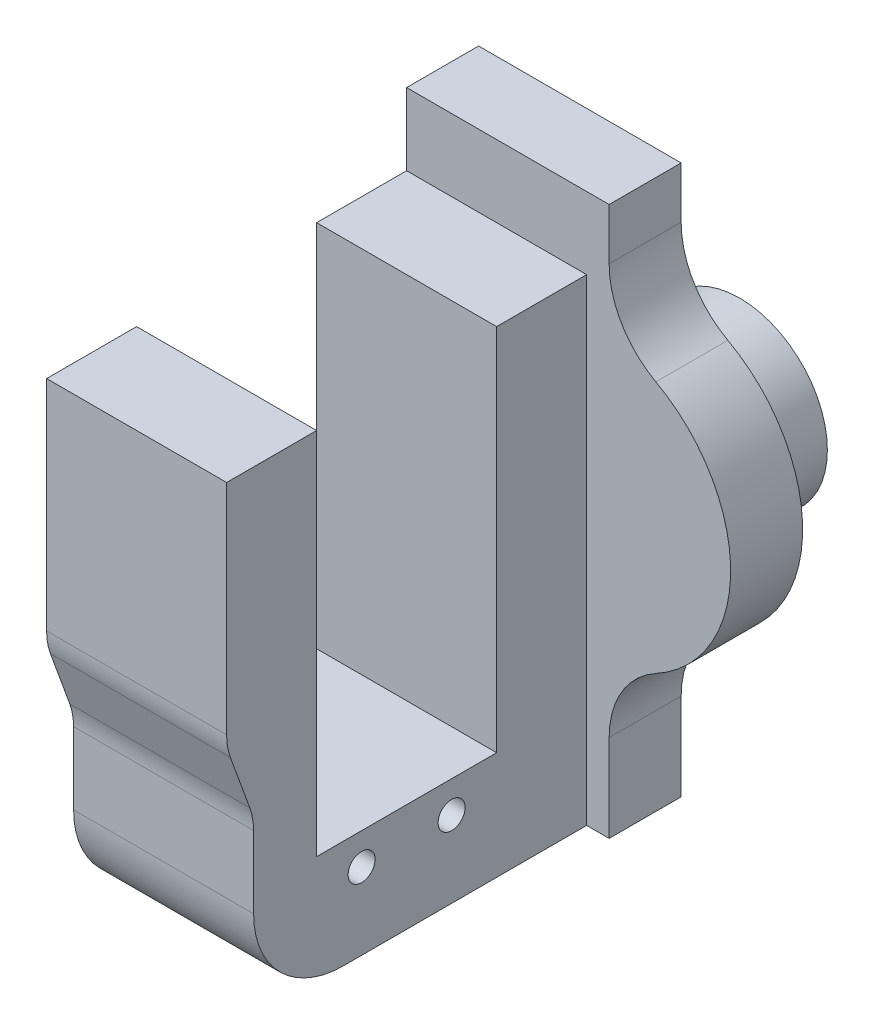
from build123d import *

# Parameters (mm, degrees)
BOSS_EXTRUDE1_DEPTH = 8
CUT_EXTRUDE3_DEPTH  = 3
BOSS_EXTRUDE4_START = 9
SKETCH10_R          = 9.75
BOSS_EXTRUDE4_DEPTH = 9
BOSS_EXTRUDE5_DEPTH = 20
SKETCH13_R          = 1.5
CUT_EXTRUDE4_DEPTH  = 10
SKETCH14_R          = 12
BOSS_EXTRUDE6_DEPTH = 1
FILLET4_R           = 10
FILLET5_R           = 7
SKETCH15_OUTSIDE_W  = 85.02
SKETCH15_OUTSIDE_H  = 105.02
CUT_EXTRUDE5_DEPTH  = 129.593694432
FILLET6_R           = 10


with BuildPart() as part:
    # Sketch3 → Boss-Extrude1 (new body)
    with BuildSketch(Plane(origin=(0, 0, 30), x_dir=(-1, 0, 0), z_dir=(0, 0, -1))):
        with BuildLine():
            Line((55, 53.257283518), (105, 53.257283518))
            ThreePointArc((105, 53.257283518), (108.535533906, 51.792817424), (110, 48.257283518))
            Line((110, 48.257283518), (110, -21.742716482))
            ThreePointArc((110, -21.742716482), (108.535533906, -25.278250388), (105, -26.742716482))
            Line((105, -26.742716482), (55, -26.742716482))
            ThreePointArc((55, -26.742716482), (51.464466094, -25.278250388), (50, -21.742716482))
            Line((50, -21.742716482), (50, 48.257283518))
            ThreePointArc((50, 48.257283518), (51.464466094, 51.792817424), (55, 53.257283518))
        make_face()
    extrude(amount=BOSS_EXTRUDE1_DEPTH)

    # Sketch8 → Cut-Extrude3 (cut)
    with BuildSketch(Plane(origin=(0, 0, 22), x_dir=(-1, 0, 0), z_dir=(0, 0, -1))):
        with BuildLine():
            Line((78.25, 15.378603862), (78.25, 11.135963175))
            ThreePointArc((78.25, 11.135963175), (80, 10.507283518), (81.75, 11.135963175))
            Line((81.75, 11.135963175), (81.75, 15.378603862))
            ThreePointArc((81.75, 15.378603862), (80, 16.007283518), (78.25, 15.378603862))
        make_face()
    extrude(amount=-CUT_EXTRUDE3_DEPTH, mode=Mode.SUBTRACT)

    # Sketch10 → Boss-Extrude4 (add)
    with BuildSketch(Plane(origin=(0, 0, 22), x_dir=(-1, 0, 0), z_dir=(0, 0, -1)).offset(BOSS_EXTRUDE4_START)):
        with Locations((80, 13.257283518)):
            Circle(SKETCH10_R)
        with BuildLine():
            Line((81.75, 11.135963175), (81.75, 15.378603862))
            ThreePointArc((81.75, 15.378603862), (80, 16.007283518), (78.25, 15.378603862))
            Line((78.25, 15.378603862), (78.25, 11.135963175))
            ThreePointArc((78.25, 11.135963175), (80, 10.507283518), (81.75, 11.135963175))
        make_face(mode=Mode.SUBTRACT)
    extrude(amount=-BOSS_EXTRUDE4_DEPTH)

    # Sketch12 → Boss-Extrude5 (add)
    with BuildSketch(Plane.ZY.offset(80)):
        Polygon((30, -19.242716482), (30, 33.757283518), (40, 33.757283518), (40, -7.242716482), (60, -7.242716482), (60, 33.757283518), (70, 33.757283518), (70, 8.239359157), (67.001118517, 0), (67.001118517, -19.242716482), align=None)
    extrude(amount=BOSS_EXTRUDE5_DEPTH)

    # Sketch13 → Cut-Extrude4 (cut)
    with BuildSketch(Plane(origin=(-80, 0, 0), x_dir=(0, 0, -1), z_dir=(1, 0, 0))):
        with Locations((-55, -10.742716482)):
            Circle(SKETCH13_R)
        with Locations((-45, -10.742716482)):
            Circle(SKETCH13_R)
        with Locations((-55, 37.257283518)):
            Circle(SKETCH13_R)
        with Locations((-45, 37.257283518)):
            Circle(SKETCH13_R)
    extrude(amount=-CUT_EXTRUDE4_DEPTH, mode=Mode.SUBTRACT)

    # Sketch14 → Boss-Extrude6 (add)
    with BuildSketch(Plane(origin=(0, 0, 22), x_dir=(-1, 0, 0), z_dir=(0, 0, -1))):
        with Locations((80, 13.257283518)):
            Circle(SKETCH14_R)
    extrude(amount=BOSS_EXTRUDE6_DEPTH)

    # Fillet4
    fillet4_edges = [part.edges().sort_by_distance(p)[0] for p in [
        (-90, -19.242716482, 67.001118517),
    ]]
    fillet(fillet4_edges, radius=FILLET4_R)

    # Fillet5
    fillet5_edges = [part.edges().sort_by_distance(p)[0] for p in [
        (-90, 8.239359157, 70),
        (-90, 0, 67.001118517),
    ]]
    fillet(fillet5_edges, radius=FILLET5_R)

    # Sketch15 outside → Cut-Extrude5 (cut, through all)
    with BuildSketch(Plane.XY.offset(30)):
        with Locations((-80, 13.257)):
            Rectangle(SKETCH15_OUTSIDE_W, SKETCH15_OUTSIDE_H)
        with BuildLine():
            Line((-77.5, 41.757283518), (-77.5, 29.060764148))
            ThreePointArc((-77.5, 29.060764148), (-64, 13.257283518), (-77.5, -2.546197111))
            Line((-77.5, -2.546197111), (-77.5, -19.242716482))
            Line((-77.5, -19.242716482), (-100, -19.242716482))
            Line((-100, -19.242716482), (-100, 41.757283518))
            Line((-100, 41.757283518), (-77.5, 41.757283518))
        make_face(mode=Mode.SUBTRACT)
    extrude(amount=-CUT_EXTRUDE5_DEPTH, mode=Mode.SUBTRACT)

    # Fillet6
    fillet6_edges = [part.edges().sort_by_distance(p)[0] for p in [
        (-77.5, -2.546197111, 26),
        (-77.5, 29.060764148, 26),
    ]]
    fillet(fillet6_edges, radius=FILLET6_R)


solid = part.part
